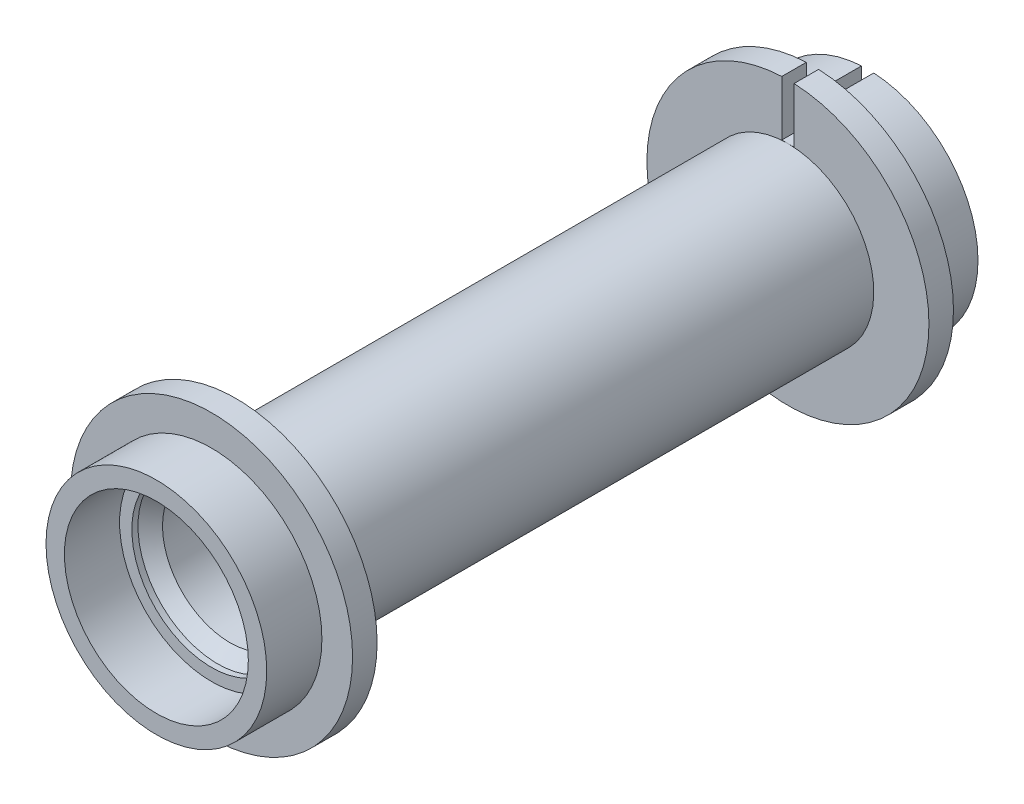
from build123d import *

# Parameters (mm, degrees)
SKETCH_1_R          = 7
SKETCH_1_R_2        = 5.5
EXTRUDE_1_DEPTH     = 45
SKETCH_2_R          = 11.5
SKETCH_2_R_2        = 6.5
EXTRUDE_2_DEPTH     = 2
SKETCH_3_R          = 9
SKETCH_3_R_2        = 7.5
EXTRUDE_3_DEPTH     = 4.5
CHAMFER_1_SIZE      = 1.5
CUT_EXTRUDE_1_REACH = 62.237
SKETCH_5_W          = 1
SKETCH_5_H          = 5.956385966


with BuildPart() as part:
    # 草图1 → 凸台-拉伸1 (new body)
    with BuildSketch(Plane.XY):
        with Locations(Location((0, 0, 0), (0, 0, 180))):
            Circle(SKETCH_1_R)
        with Locations(Location((0, 0, 0), (0, 0, 180))):
            Circle(SKETCH_1_R_2, mode=Mode.SUBTRACT)
    extrude(amount=EXTRUDE_1_DEPTH)

    # 草图2 → 凸台-拉伸2 (add)
    with BuildSketch(Plane.XY.offset(45)):
        Circle(SKETCH_2_R)
        Circle(SKETCH_2_R_2, mode=Mode.SUBTRACT)
    extrude_2 = extrude(amount=EXTRUDE_2_DEPTH)

    # 草图3 → 凸台-拉伸3 (add)
    with BuildSketch(Plane.XY.offset(47)):
        Circle(SKETCH_3_R)
        Circle(SKETCH_3_R_2, mode=Mode.SUBTRACT)
    extrude_3 = extrude(amount=EXTRUDE_3_DEPTH)

    # 镜向16: 凸台-拉伸2, 凸台-拉伸3 across plane
    add(extrude_2.mirror(Plane(origin=(0, 0, 22.5), x_dir=(1, 0, 0), z_dir=(0, 0, -1))))
    add(extrude_3.mirror(Plane(origin=(0, 0, 22.5), x_dir=(1, 0, 0), z_dir=(0, 0, -1))))

    # 倒角1
    # the kernel refuses this chamfer: 1.5 mm, written as the material it adds along each edge
    with BuildSketch(Plane(origin=(0, 0, 45), x_dir=(1, 0, 0), z_dir=(0, -1, 0))) as chamfer_1_piece_1_section:
        Polygon((6.5, CHAMFER_1_SIZE), (6.5 - CHAMFER_1_SIZE, 0), (6.5, 0), align=None)
    chamfer_1_piece_1 = revolve(axis=Axis((0, 0, 45), (0, 0, 1)), mode=Mode.PRIVATE)
    chamfer_1_piece_1 = chamfer_1_piece_1 - Plane(origin=(0, 0, 45.996711571), x_dir=(-1, 0, 0), z_dir=(0, 0, -1)) * Cylinder(5.5, 26, mode=Mode.PRIVATE)
    add(chamfer_1_piece_1)
    with BuildSketch(Plane(origin=(0, 0, 0), x_dir=(1, 0, 0), z_dir=(0, -1, 0))) as chamfer_1_piece_2_section:
        Polygon((6.5, -CHAMFER_1_SIZE), (6.5 - CHAMFER_1_SIZE, 0), (6.5, 0), align=None)
    chamfer_1_piece_2 = revolve(axis=Axis((0, 0, 0), (0, 0, 1)), mode=Mode.PRIVATE)
    chamfer_1_piece_2 = chamfer_1_piece_2 - Plane(origin=(0, 0, -0.996711571), x_dir=(-1, 0, 0), z_dir=(0, 0, -1)) * Cylinder(5.5, 26, mode=Mode.PRIVATE)
    add(chamfer_1_piece_2)

    # 切除-拉伸1: up to this face of the body (flat: up to its plane)
    cut_extrude_1_end = Plane(part.part.faces().sort_by_distance((-11.174730881, 0, 0))[0])
    # 草图5 → 切除-拉伸1 (cut, up to the picked face)
    with BuildSketch(Plane(origin=(0, 0, -6.5), x_dir=(-1, 0, 0), z_dir=(0, 0, -1)), mode=Mode.PRIVATE) as cut_extrude_1_sk1:
        with Locations((0, 9.978192983)):
            Rectangle(SKETCH_5_W, SKETCH_5_H)
    cut_extrude_1_tool1 = split(extrude(cut_extrude_1_sk1.sketch, amount=-CUT_EXTRUDE_1_REACH, mode=Mode.PRIVATE), bisect_by=cut_extrude_1_end, keep=Keep.BOTH, mode=Mode.PRIVATE)
    add(cut_extrude_1_tool1.solids().sort_by(Axis((0, 9.978193, -6.5), (0, 0, 1)))[0], mode=Mode.SUBTRACT)


solid = part.part
